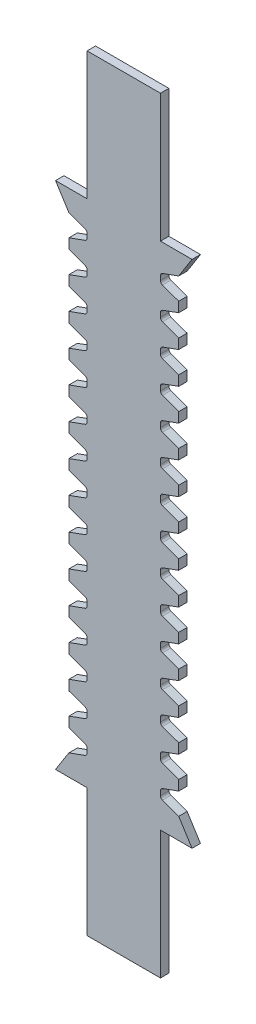
from build123d import *

# Parameters (mm, degrees)
SKETCHCI_M_STRSKETCHNAME_W         = 52.165695238
SKETCHCI_M_STRSKETCHNAME_H         = 453.902916577
EXTRUDECI_DEPTH                    = 4
TOOTHEXTRUDECUTGEARTRAX1GEAR_DEPTH = 4
PATTERNGEARTRAX1GEAR_COUNT         = 15
PATTERNGEARTRAX1GEAR_PITCH         = 30.260194893
MIRROR1_COPY_1_DEPTH               = 4
MIRROR1_COPY_2_DEPTH               = 4
MIRROR1_COPY_3_DEPTH               = 4
MIRROR1_COPY_4_DEPTH               = 4
MIRROR1_COPY_5_DEPTH               = 4
MIRROR1_COPY_6_DEPTH               = 4
MIRROR1_COPY_7_DEPTH               = 4
MIRROR1_COPY_8_DEPTH               = 4
MIRROR1_COPY_9_DEPTH               = 4
MIRROR1_COPY_10_DEPTH              = 4
MIRROR1_COPY_11_DEPTH              = 4
MIRROR1_COPY_12_DEPTH              = 4
MIRROR1_COPY_13_DEPTH              = 4
MIRROR1_COPY_14_DEPTH              = 4
BOSS_EXTRUDE1_DEPTH                = 8


with BuildPart() as part:
    # SketchCI.m_strSketchName → ExtrudeCI (new, symmetric)
    with BuildSketch(Plane.XY):
        with Locations((18.377152381, -211.82136107)):
            Rectangle(SKETCHCI_M_STRSKETCHNAME_W, SKETCHCI_M_STRSKETCHNAME_H)
    extrudeci = extrude(amount=EXTRUDECI_DEPTH, both=True)

    # SketchToothGeartrax1Gear → ToothExtrudeCutGeartrax1Gear (cut, symmetric)
    with BuildSketch(Plane.XY):
        with BuildLine():
            Line((-7.705695238, 10.369692311), (-7.705695238, -10.369692311))
            Line((-7.705695238, -10.369692311), (7.730796954, -4.751268631))
            ThreePointArc((7.730796954, -4.751268631), (9.109534336, -3.693326229), (9.632119048, -2.035899274))
            Line((9.632119048, -2.035899274), (9.632119048, 2.035899274))
            ThreePointArc((9.632119048, 2.035899274), (9.109534336, 3.693326229), (7.730796954, 4.751268631))
            Line((7.730796954, 4.751268631), (-7.705695238, 10.369692311))
        make_face()
    toothextrudecutgeartrax1gear = extrude(amount=TOOTHEXTRUDECUTGEARTRAX1GEAR_DEPTH, both=True, mode=Mode.SUBTRACT)

    # PatternGeartrax1Gear: ToothExtrudeCutGeartrax1Gear ×15
    with Locations(*[(0, -i * PATTERNGEARTRAX1GEAR_PITCH, 0) for i in range(1, PATTERNGEARTRAX1GEAR_COUNT)]):
        add(toothextrudecutgeartrax1gear, mode=Mode.SUBTRACT)

    # Mirror1: ExtrudeCI, ToothExtrudeCutGeartrax1Gear across plane
    add(extrudeci.mirror(Plane(origin=(44.46, -438.772819358, -4), x_dir=(0, 0, 1), z_dir=(1, 0, 0))))
    add(toothextrudecutgeartrax1gear.mirror(Plane(origin=(44.46, -438.772819358, -4), x_dir=(0, 0, 1), z_dir=(1, 0, 0))), mode=Mode.SUBTRACT)

    # Mirror1 copy 1 sketch → Mirror1 copy 1 (cut, symmetric)
    with BuildSketch(Plane(origin=(88.92, -30.260194893, 0), x_dir=(-1, 0, 0), z_dir=(0, 0, 1))):
        with BuildLine():
            Line((-7.705695238, -10.369692311), (-7.705695238, 10.369692311))
            Line((-7.705695238, 10.369692311), (7.730796954, 4.751268631))
            ThreePointArc((7.730796954, 4.751268631), (9.109534336, 3.693326229), (9.632119048, 2.035899274))
            Line((9.632119048, 2.035899274), (9.632119048, -2.035899274))
            ThreePointArc((9.632119048, -2.035899274), (9.109534336, -3.693326229), (7.730796954, -4.751268631))
            Line((7.730796954, -4.751268631), (-7.705695238, -10.369692311))
        make_face()
    extrude(amount=MIRROR1_COPY_1_DEPTH, both=True, mode=Mode.SUBTRACT)

    # Mirror1 copy 2 sketch → Mirror1 copy 2 (cut, symmetric)
    with BuildSketch(Plane(origin=(88.92, -60.520389786, 0), x_dir=(-1, 0, 0), z_dir=(0, 0, 1))):
        with BuildLine():
            Line((-7.705695238, -10.369692311), (-7.705695238, 10.369692311))
            Line((-7.705695238, 10.369692311), (7.730796954, 4.751268631))
            ThreePointArc((7.730796954, 4.751268631), (9.109534336, 3.693326229), (9.632119048, 2.035899274))
            Line((9.632119048, 2.035899274), (9.632119048, -2.035899274))
            ThreePointArc((9.632119048, -2.035899274), (9.109534336, -3.693326229), (7.730796954, -4.751268631))
            Line((7.730796954, -4.751268631), (-7.705695238, -10.369692311))
        make_face()
    extrude(amount=MIRROR1_COPY_2_DEPTH, both=True, mode=Mode.SUBTRACT)

    # Mirror1 copy 3 sketch → Mirror1 copy 3 (cut, symmetric)
    with BuildSketch(Plane(origin=(88.92, -90.780584679, 0), x_dir=(-1, 0, 0), z_dir=(0, 0, 1))):
        with BuildLine():
            Line((-7.705695238, -10.369692311), (-7.705695238, 10.369692311))
            Line((-7.705695238, 10.369692311), (7.730796954, 4.751268631))
            ThreePointArc((7.730796954, 4.751268631), (9.109534336, 3.693326229), (9.632119048, 2.035899274))
            Line((9.632119048, 2.035899274), (9.632119048, -2.035899274))
            ThreePointArc((9.632119048, -2.035899274), (9.109534336, -3.693326229), (7.730796954, -4.751268631))
            Line((7.730796954, -4.751268631), (-7.705695238, -10.369692311))
        make_face()
    extrude(amount=MIRROR1_COPY_3_DEPTH, both=True, mode=Mode.SUBTRACT)

    # Mirror1 copy 4 sketch → Mirror1 copy 4 (cut, symmetric)
    with BuildSketch(Plane(origin=(88.92, -121.040779572, 0), x_dir=(-1, 0, 0), z_dir=(0, 0, 1))):
        with BuildLine():
            Line((-7.705695238, -10.369692311), (-7.705695238, 10.369692311))
            Line((-7.705695238, 10.369692311), (7.730796954, 4.751268631))
            ThreePointArc((7.730796954, 4.751268631), (9.109534336, 3.693326229), (9.632119048, 2.035899274))
            Line((9.632119048, 2.035899274), (9.632119048, -2.035899274))
            ThreePointArc((9.632119048, -2.035899274), (9.109534336, -3.693326229), (7.730796954, -4.751268631))
            Line((7.730796954, -4.751268631), (-7.705695238, -10.369692311))
        make_face()
    extrude(amount=MIRROR1_COPY_4_DEPTH, both=True, mode=Mode.SUBTRACT)

    # Mirror1 copy 5 sketch → Mirror1 copy 5 (cut, symmetric)
    with BuildSketch(Plane(origin=(88.92, -151.300974465, 0), x_dir=(-1, 0, 0), z_dir=(0, 0, 1))):
        with BuildLine():
            Line((-7.705695238, -10.369692311), (-7.705695238, 10.369692311))
            Line((-7.705695238, 10.369692311), (7.730796954, 4.751268631))
            ThreePointArc((7.730796954, 4.751268631), (9.109534336, 3.693326229), (9.632119048, 2.035899274))
            Line((9.632119048, 2.035899274), (9.632119048, -2.035899274))
            ThreePointArc((9.632119048, -2.035899274), (9.109534336, -3.693326229), (7.730796954, -4.751268631))
            Line((7.730796954, -4.751268631), (-7.705695238, -10.369692311))
        make_face()
    extrude(amount=MIRROR1_COPY_5_DEPTH, both=True, mode=Mode.SUBTRACT)

    # Mirror1 copy 6 sketch → Mirror1 copy 6 (cut, symmetric)
    with BuildSketch(Plane(origin=(88.92, -181.561169358, 0), x_dir=(-1, 0, 0), z_dir=(0, 0, 1))):
        with BuildLine():
            Line((-7.705695238, -10.369692311), (-7.705695238, 10.369692311))
            Line((-7.705695238, 10.369692311), (7.730796954, 4.751268631))
            ThreePointArc((7.730796954, 4.751268631), (9.109534336, 3.693326229), (9.632119048, 2.035899274))
            Line((9.632119048, 2.035899274), (9.632119048, -2.035899274))
            ThreePointArc((9.632119048, -2.035899274), (9.109534336, -3.693326229), (7.730796954, -4.751268631))
            Line((7.730796954, -4.751268631), (-7.705695238, -10.369692311))
        make_face()
    extrude(amount=MIRROR1_COPY_6_DEPTH, both=True, mode=Mode.SUBTRACT)

    # Mirror1 copy 7 sketch → Mirror1 copy 7 (cut, symmetric)
    with BuildSketch(Plane(origin=(88.92, -211.821364251, 0), x_dir=(-1, 0, 0), z_dir=(0, 0, 1))):
        with BuildLine():
            Line((-7.705695238, -10.369692311), (-7.705695238, 10.369692311))
            Line((-7.705695238, 10.369692311), (7.730796954, 4.751268631))
            ThreePointArc((7.730796954, 4.751268631), (9.109534336, 3.693326229), (9.632119048, 2.035899274))
            Line((9.632119048, 2.035899274), (9.632119048, -2.035899274))
            ThreePointArc((9.632119048, -2.035899274), (9.109534336, -3.693326229), (7.730796954, -4.751268631))
            Line((7.730796954, -4.751268631), (-7.705695238, -10.369692311))
        make_face()
    extrude(amount=MIRROR1_COPY_7_DEPTH, both=True, mode=Mode.SUBTRACT)

    # Mirror1 copy 8 sketch → Mirror1 copy 8 (cut, symmetric)
    with BuildSketch(Plane(origin=(88.92, -242.081559144, 0), x_dir=(-1, 0, 0), z_dir=(0, 0, 1))):
        with BuildLine():
            Line((-7.705695238, -10.369692311), (-7.705695238, 10.369692311))
            Line((-7.705695238, 10.369692311), (7.730796954, 4.751268631))
            ThreePointArc((7.730796954, 4.751268631), (9.109534336, 3.693326229), (9.632119048, 2.035899274))
            Line((9.632119048, 2.035899274), (9.632119048, -2.035899274))
            ThreePointArc((9.632119048, -2.035899274), (9.109534336, -3.693326229), (7.730796954, -4.751268631))
            Line((7.730796954, -4.751268631), (-7.705695238, -10.369692311))
        make_face()
    extrude(amount=MIRROR1_COPY_8_DEPTH, both=True, mode=Mode.SUBTRACT)

    # Mirror1 copy 9 sketch → Mirror1 copy 9 (cut, symmetric)
    with BuildSketch(Plane(origin=(88.92, -272.341754037, 0), x_dir=(-1, 0, 0), z_dir=(0, 0, 1))):
        with BuildLine():
            Line((-7.705695238, -10.369692311), (-7.705695238, 10.369692311))
            Line((-7.705695238, 10.369692311), (7.730796954, 4.751268631))
            ThreePointArc((7.730796954, 4.751268631), (9.109534336, 3.693326229), (9.632119048, 2.035899274))
            Line((9.632119048, 2.035899274), (9.632119048, -2.035899274))
            ThreePointArc((9.632119048, -2.035899274), (9.109534336, -3.693326229), (7.730796954, -4.751268631))
            Line((7.730796954, -4.751268631), (-7.705695238, -10.369692311))
        make_face()
    extrude(amount=MIRROR1_COPY_9_DEPTH, both=True, mode=Mode.SUBTRACT)

    # Mirror1 copy 10 sketch → Mirror1 copy 10 (cut, symmetric)
    with BuildSketch(Plane(origin=(88.92, -302.60194893, 0), x_dir=(-1, 0, 0), z_dir=(0, 0, 1))):
        with BuildLine():
            Line((-7.705695238, -10.369692311), (-7.705695238, 10.369692311))
            Line((-7.705695238, 10.369692311), (7.730796954, 4.751268631))
            ThreePointArc((7.730796954, 4.751268631), (9.109534336, 3.693326229), (9.632119048, 2.035899274))
            Line((9.632119048, 2.035899274), (9.632119048, -2.035899274))
            ThreePointArc((9.632119048, -2.035899274), (9.109534336, -3.693326229), (7.730796954, -4.751268631))
            Line((7.730796954, -4.751268631), (-7.705695238, -10.369692311))
        make_face()
    extrude(amount=MIRROR1_COPY_10_DEPTH, both=True, mode=Mode.SUBTRACT)

    # Mirror1 copy 11 sketch → Mirror1 copy 11 (cut, symmetric)
    with BuildSketch(Plane(origin=(88.92, -332.862143823, 0), x_dir=(-1, 0, 0), z_dir=(0, 0, 1))):
        with BuildLine():
            Line((-7.705695238, -10.369692311), (-7.705695238, 10.369692311))
            Line((-7.705695238, 10.369692311), (7.730796954, 4.751268631))
            ThreePointArc((7.730796954, 4.751268631), (9.109534336, 3.693326229), (9.632119048, 2.035899274))
            Line((9.632119048, 2.035899274), (9.632119048, -2.035899274))
            ThreePointArc((9.632119048, -2.035899274), (9.109534336, -3.693326229), (7.730796954, -4.751268631))
            Line((7.730796954, -4.751268631), (-7.705695238, -10.369692311))
        make_face()
    extrude(amount=MIRROR1_COPY_11_DEPTH, both=True, mode=Mode.SUBTRACT)

    # Mirror1 copy 12 sketch → Mirror1 copy 12 (cut, symmetric)
    with BuildSketch(Plane(origin=(88.92, -363.122338716, 0), x_dir=(-1, 0, 0), z_dir=(0, 0, 1))):
        with BuildLine():
            Line((-7.705695238, -10.369692311), (-7.705695238, 10.369692311))
            Line((-7.705695238, 10.369692311), (7.730796954, 4.751268631))
            ThreePointArc((7.730796954, 4.751268631), (9.109534336, 3.693326229), (9.632119048, 2.035899274))
            Line((9.632119048, 2.035899274), (9.632119048, -2.035899274))
            ThreePointArc((9.632119048, -2.035899274), (9.109534336, -3.693326229), (7.730796954, -4.751268631))
            Line((7.730796954, -4.751268631), (-7.705695238, -10.369692311))
        make_face()
    extrude(amount=MIRROR1_COPY_12_DEPTH, both=True, mode=Mode.SUBTRACT)

    # Mirror1 copy 13 sketch → Mirror1 copy 13 (cut, symmetric)
    with BuildSketch(Plane(origin=(88.92, -393.382533609, 0), x_dir=(-1, 0, 0), z_dir=(0, 0, 1))):
        with BuildLine():
            Line((-7.705695238, -10.369692311), (-7.705695238, 10.369692311))
            Line((-7.705695238, 10.369692311), (7.730796954, 4.751268631))
            ThreePointArc((7.730796954, 4.751268631), (9.109534336, 3.693326229), (9.632119048, 2.035899274))
            Line((9.632119048, 2.035899274), (9.632119048, -2.035899274))
            ThreePointArc((9.632119048, -2.035899274), (9.109534336, -3.693326229), (7.730796954, -4.751268631))
            Line((7.730796954, -4.751268631), (-7.705695238, -10.369692311))
        make_face()
    extrude(amount=MIRROR1_COPY_13_DEPTH, both=True, mode=Mode.SUBTRACT)

    # Mirror1 copy 14 sketch → Mirror1 copy 14 (cut, symmetric)
    with BuildSketch(Plane(origin=(88.92, -423.642728502, 0), x_dir=(-1, 0, 0), z_dir=(0, 0, 1))):
        with BuildLine():
            Line((-7.705695238, -10.369692311), (-7.705695238, 10.369692311))
            Line((-7.705695238, 10.369692311), (7.730796954, 4.751268631))
            ThreePointArc((7.730796954, 4.751268631), (9.109534336, 3.693326229), (9.632119048, 2.035899274))
            Line((9.632119048, 2.035899274), (9.632119048, -2.035899274))
            ThreePointArc((9.632119048, -2.035899274), (9.109534336, -3.693326229), (7.730796954, -4.751268631))
            Line((7.730796954, -4.751268631), (-7.705695238, -10.369692311))
        make_face()
    extrude(amount=MIRROR1_COPY_14_DEPTH, both=True, mode=Mode.SUBTRACT)

    # Sketch1 → Boss-Extrude1 (add)
    with BuildSketch(Plane.XY.offset(4)):
        Polygon((9.632119048, 2.035899274), (9.632119048, 10.369692311), (-7.705695238, 10.369692311), (-20.367880952, 30.369692311), (9.632119048, 30.369692311), (9.632119048, 152.035899274), (79.287880952, 152.035899274), (79.287880952, 30.369692311), (109.287880952, 30.369692311), (96.625695238, 10.369692311), (79.287880952, 10.369692311), (79.287880952, 2.035899274), align=None)
        Polygon((9.632119048, -425.678627775), (9.632119048, -434.012420812), (-7.705695238, -434.012420812), (-20.367880952, -454.012420812), (9.632119048, -454.012420812), (9.632119048, -575.678627775), (79.287880952, -575.678627775), (79.287880952, -454.012420812), (109.287880952, -454.012420812), (96.625695238, -434.012420812), (79.287880952, -434.012420812), (79.287880952, -425.678627775), align=None)
    extrude(amount=-BOSS_EXTRUDE1_DEPTH)


solid = part.part
